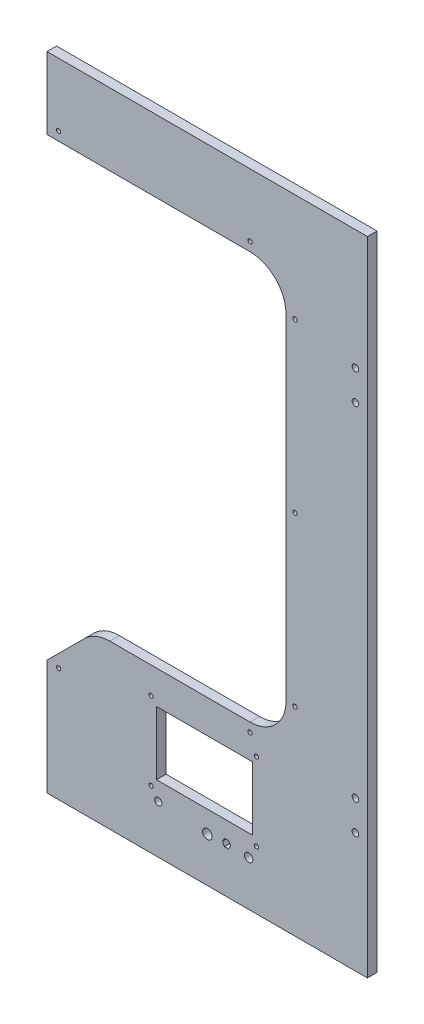
from build123d import *

# Parameters (mm, degrees)
SKETCH1_W           = 267.5
SKETCH1_H           = 536
SKETCH1_R           = 2.75
BOSS_EXTRUDE1_DEPTH = 8
SKETCH3_R           = 2.75
SKETCH3_R_2         = 1.75
SKETCH3_R_3         = 3.5
SKETCH3_R_4         = 4
SKETCH3_R_5         = 3
SKETCH3_W           = 80
SKETCH3_H           = 53
CUT_EXTRUDE3_DEPTH  = 379.740346412
SKETCH4_R           = 1.75
SKETCH4_R_2         = 1.786950001
CUT_EXTRUDE4_DEPTH  = 10


with BuildPart() as part:
    # Sketch1 → Boss-Extrude1 (new body)
    with BuildSketch(Plane.XY):
        with Locations((133.75, 0)):
            Rectangle(SKETCH1_W, SKETCH1_H)
        with Locations((257.5, -168)):
            Circle(SKETCH1_R, mode=Mode.SUBTRACT)
        with Locations((257.509341423, -143.000001745)):
            Circle(SKETCH1_R, mode=Mode.SUBTRACT)
        with Locations((257.509341423, 143.000001745)):
            Circle(SKETCH1_R, mode=Mode.SUBTRACT)
        with Locations((257.5, 168)):
            Circle(SKETCH1_R, mode=Mode.SUBTRACT)
    extrude(amount=-BOSS_EXTRUDE1_DEPTH)

    # Sketch3 → Cut-Extrude3 (cut, through all)
    with BuildSketch(Plane.XY):
        with Locations((257.509341423, -143.000001745)):
            Circle(SKETCH3_R)
        with Locations((257.5, -168)):
            Circle(SKETCH3_R)
        with Locations((86.878100048, -154.208377346)):
            Circle(SKETCH3_R_2)
        with Locations((174.878100048, -154.208377346)):
            Circle(SKETCH3_R_2)
        with Locations((174.878100048, -219.208377346)):
            Circle(SKETCH3_R_2)
        with Locations((86.878100048, -219.208377346)):
            Circle(SKETCH3_R_2)
        with Locations((168.378100048, -230.458377346)):
            Circle(SKETCH3_R_3)
        with Locations((133.878100048, -230.708377346)):
            Circle(SKETCH3_R_4)
        with Locations((92.878100048, -227.708377346)):
            Circle(SKETCH3_R_5)
        with BuildLine():
            Line((0, 208), (0, -172))
            Line((0, -172), (31.225700951, -140.783627636))
            ThreePointArc((31.225700951, -140.783627636), (40.957302403, -134.282756532), (52.435734985, -132))
            Line((52.435734985, -132), (169.5, -132))
            ThreePointArc((169.5, -132), (190.713203436, -123.213203436), (199.5, -102))
            Line((199.5, -102), (199.5, 178))
            ThreePointArc((199.5, 178), (190.713203436, 199.213203436), (169.5, 208))
            Line((169.5, 208), (0, 208))
        make_face()
        Polygon((153.342201663, -229.708377346), (151.610150855, -226.708377346), (148.14604924, -226.708377346), (146.413998433, -229.708377346), (148.14604924, -232.708377346), (151.610150855, -232.708377346), align=None)
        with Locations((131.378100048, -186.208377346)):
            Rectangle(SKETCH3_W, SKETCH3_H)
    extrude(amount=-CUT_EXTRUDE3_DEPTH, mode=Mode.SUBTRACT)

    # Sketch4 → Cut-Extrude4 (cut)
    with BuildSketch(Plane.XY):
        with Locations((9.726391767, -172.881531455)):
            Circle(SKETCH4_R)
        with Locations((169.5, -139.5)):
            Circle(SKETCH4_R_2)
        with Locations((207, -102)):
            Circle(SKETCH4_R)
        with Locations((207, 38)):
            Circle(SKETCH4_R)
        with Locations((207, 178)):
            Circle(SKETCH4_R)
        with Locations((169.5, 215.5)):
            Circle(SKETCH4_R)
        with Locations((9.726391767, 215.5)):
            Circle(SKETCH4_R)
    extrude(amount=-CUT_EXTRUDE4_DEPTH, mode=Mode.SUBTRACT)


solid = part.part
